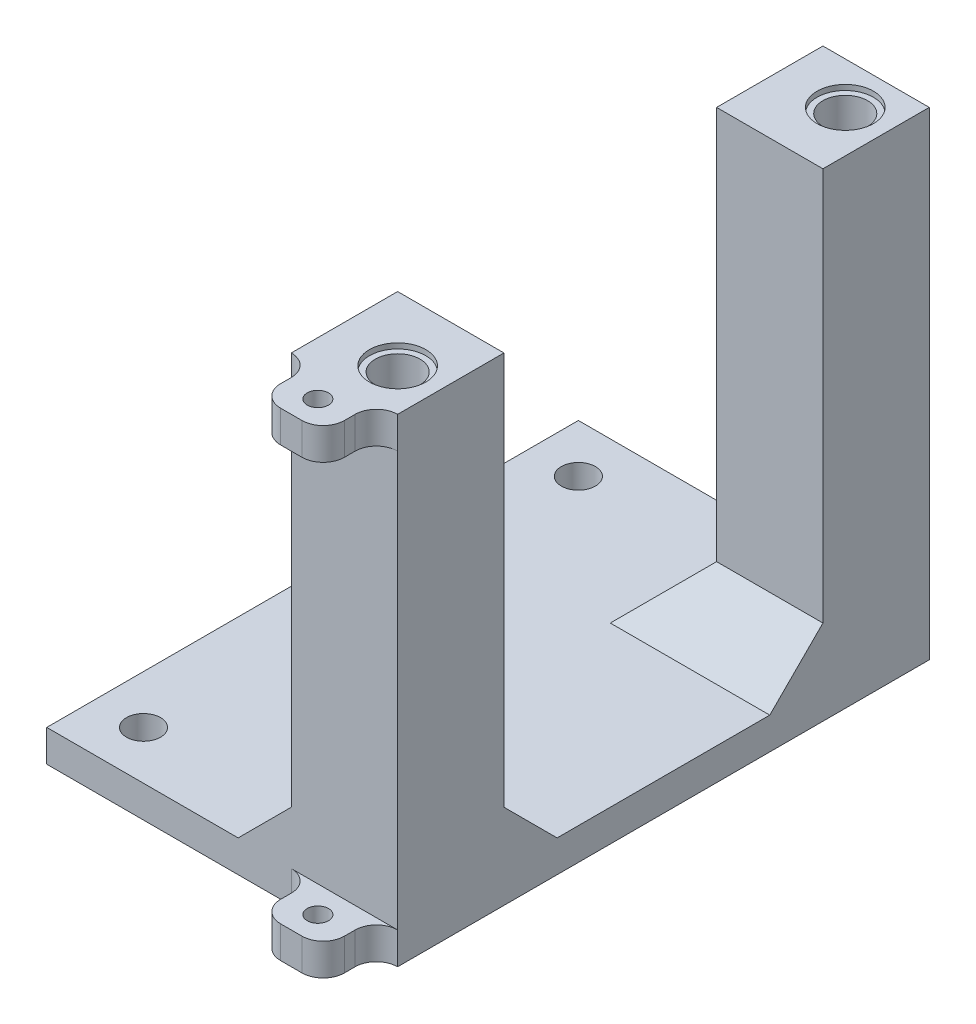
from build123d import *

# Parameters (mm, degrees)
SKETCH1_R           = 1.6
BOSS_EXTRUDE1_DEPTH = 3
SKETCH2_W           = 10
SKETCH2_H           = 10
BOSS_EXTRUDE2_DEPTH = 42
CHAMFER1_SIZE       = 5
SKETCH3_R           = 2.1
CUT_EXTRUDE1_DEPTH  = 52
SKETCH4_R           = 2.65
CUT_EXTRUDE2_DEPTH  = 0.5
SKETCH11_W          = 6
SKETCH11_H          = 3
BOSS_EXTRUDE7_DEPTH = 5
SKETCH12_R          = 1
CUT_EXTRUDE5_DEPTH  = 70.137227445
FILLET1_R           = 2


with BuildPart() as part:
    # Sketch1 → Boss-Extrude1 (new body)
    with BuildSketch(Plane(origin=(0, 0, 0), x_dir=(1, 0, 0), z_dir=(0, 1, 0))):
        Polygon((-6.512396694, 9.685950413), (1.487603306, 9.685950413), (26.487603306, 9.685950413), (26.487603306, -40.314049587), (1.487603306, -40.314049587), (-6.512396694, -40.314049587), align=None)
        with Locations(Location((-1.962396694, -35.764049587, 0), (0, 0, 270))):
            Circle(SKETCH1_R, mode=Mode.SUBTRACT)
        with Locations(Location((-1.962396694, 5.135950413, 0), (0, 0, 270))):
            Circle(SKETCH1_R, mode=Mode.SUBTRACT)
    extrude(amount=BOSS_EXTRUDE1_DEPTH)

    # Sketch2 → Boss-Extrude2 (add)
    with BuildSketch(Plane(origin=(0, 3, 0), x_dir=(1, 0, 0), z_dir=(0, 1, 0))):
        with Locations((21.487603306, -35.314049587)):
            Rectangle(SKETCH2_W, SKETCH2_H)
        with Locations((21.487603306, 4.685950413)):
            Rectangle(SKETCH2_W, SKETCH2_H)
    extrude(amount=BOSS_EXTRUDE2_DEPTH)

    # Chamfer1
    chamfer1_edges = [part.edges().sort_by_distance(p)[0] for p in [
        (21.487603306, 3, 30.314049587),
        (16.487603306, 3, 35.314049587),
        (16.487603306, 3, -4.685950413),
        (21.487603306, 3, 0.314049587),
    ]]
    chamfer(chamfer1_edges, length=CHAMFER1_SIZE)

    # Sketch3 → Cut-Extrude1 (cut)
    with BuildSketch(Plane(origin=(0, 45, 0), x_dir=(1, 0, 0), z_dir=(0, 1, 0))):
        with Locations(Location((22.537603306, -36.364049587, 0), (0, 0, 270))):
            Circle(SKETCH3_R)
        with Locations(Location((22.537603306, 5.735950413, 0), (0, 0, 270))):
            Circle(SKETCH3_R)
    extrude(amount=-CUT_EXTRUDE1_DEPTH, mode=Mode.SUBTRACT)

    # Sketch4 → Cut-Extrude2 (cut)
    with BuildSketch(Plane(origin=(0, 45, 0), x_dir=(1, 0, 0), z_dir=(0, 1, 0))):
        with Locations(Location((22.537603306, -36.364049587, 0), (0, 0, 270))):
            Circle(SKETCH4_R)
        with Locations(Location((22.537603306, 5.735950413, 0), (0, 0, 270))):
            Circle(SKETCH4_R)
    cut_extrude2 = extrude(amount=-CUT_EXTRUDE2_DEPTH, mode=Mode.SUBTRACT)

    # Mirror1: Cut-Extrude2 across plane
    add(cut_extrude2.mirror(Plane(origin=(0, 22.5, 0), x_dir=(0, 0, 1), z_dir=(0, -1, 0))), mode=Mode.SUBTRACT)

    # Sketch11 → Boss-Extrude7 (add)
    with BuildSketch(Plane.XY.offset(40.314049587)):
        with Locations((21.487603306, 43.5)):
            Rectangle(SKETCH11_W, SKETCH11_H)
        with Locations((21.487603306, 1.5)):
            Rectangle(SKETCH11_W, SKETCH11_H)
    extrude(amount=BOSS_EXTRUDE7_DEPTH)

    # Sketch12 → Cut-Extrude5 (cut, through all)
    with BuildSketch(Plane.XZ):
        with Locations(Location((21.487603306, 42.814049587, 0), (0, 0, 270))):
            Circle(SKETCH12_R)
    extrude(amount=-CUT_EXTRUDE5_DEPTH, mode=Mode.SUBTRACT)

    # Fillet1
    fillet1_edges = [part.edges().sort_by_distance(p)[0] for p in [
        (18.487603306, 43.5, 40.314049587),
        (24.487603306, 43.5, 40.314049587),
        (18.487603306, 1.5, 40.314049587),
        (24.487603306, 1.5, 40.314049587),
    ]]
    fillet(fillet1_edges, radius=FILLET1_R - 0.0001)  # a hair under: the kernel refuses the full size
    fillet1_2_edges = [part.edges().sort_by_distance(p)[0] for p in [
        (18.487603306, 43.5, 45.314049587),
        (24.487603306, 43.5, 45.314049587),
        (24.487603306, 1.5, 45.314049587),
        (18.487603306, 1.5, 45.314049587),
    ]]
    fillet(fillet1_2_edges, radius=FILLET1_R)


solid = part.part
